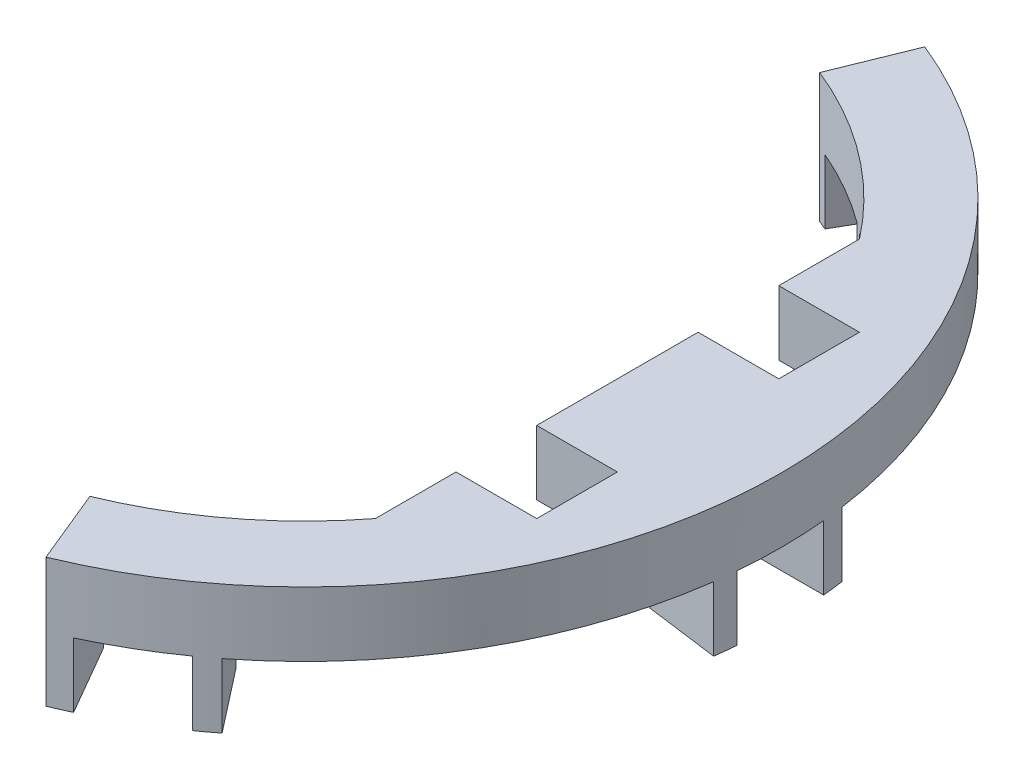
from build123d import *

# Parameters (mm, degrees)
BOSS_EXTRUDE1_DEPTH   = 8
BOSS_EXTRUDE1_2_DEPTH = 8
BOSS_EXTRUDE1_3_DEPTH = 8
BOSS_EXTRUDE1_4_DEPTH = 8
BOSS_EXTRUDE1_5_DEPTH = 8
BOSS_EXTRUDE1_6_DEPTH = 8
BOSS_EXTRUDE2_DEPTH   = 8
BOSS_EXTRUDE3_DEPTH   = 8
SKETCH7_W             = 10
SKETCH7_H             = 10
CUT_EXTRUDE1_DEPTH    = 70


with BuildPart() as part:
    # Sketch1 → Boss-Extrude1 (new body)
    with BuildSketch(Plane(origin=(0, 0, 0), x_dir=(1, 0, 0), z_dir=(0, 1, 0))):
        with BuildLine():
            Line((48.53037343, 6.767780637), (58.434531273, 8.148960359))
            ThreePointArc((58.434531273, 8.148960359), (58.599760274, 6.860619197), (58.736587944, 5.568952925))
            Line((58.736587944, 5.568952925), (48.68250983, 5.568952925))
            ThreePointArc((48.68250983, 5.568952925), (48.61013747, 6.168835799), (48.53037343, 6.767780637))
        make_face()
    extrude(amount=BOSS_EXTRUDE1_DEPTH)



with BuildPart() as body_2:
    # Sketch1 → Boss-Extrude1 2 (new body)
    with BuildSketch(Plane(origin=(0, 0, 0), x_dir=(1, 0, 0), z_dir=(0, 1, 0))):
        with BuildLine():
            Line((18.404116756, 45.412426564), (22.160058951, 54.68026872))
            ThreePointArc((22.160058951, 54.68026872), (23.358409627, 54.179190652), (24.545439267, 53.651853754))
            Line((24.545439267, 53.651853754), (19.518400209, 44.944766695))
            ThreePointArc((19.518400209, 44.944766695), (18.962700221, 45.18203183), (18.404116756, 45.412426564))
        make_face()
    extrude(amount=BOSS_EXTRUDE1_2_DEPTH)


with BuildPart() as body_3:
    # Sketch1 → Boss-Extrude1 3 (new body)
    with BuildSketch(Plane(origin=(0, 0, 0), x_dir=(1, 0, 0), z_dir=(0, 1, 0))):
        with BuildLine():
            Line((29.904437191, 38.816551061), (36.007383557, 46.738296175))
            ThreePointArc((36.007383557, 46.738296175), (34.969196448, 47.520051555), (33.914042358, 48.278750304))
            Line((33.914042358, 48.278750304), (28.890208092, 39.577214106))
            ThreePointArc((28.890208092, 39.577214106), (29.399782832, 39.200162875), (29.904437191, 38.816551061))
        make_face()
    extrude(amount=BOSS_EXTRUDE1_3_DEPTH)


with BuildPart() as body_4:
    # Sketch1 → Boss-Extrude1 4 (new body)
    with BuildSketch(Plane(origin=(0, 0, 0), x_dir=(1, 0, 0), z_dir=(0, 1, 0))):
        with BuildLine():
            Line((48.568337902, -6.489726763), (58.480243596, -7.814160796))
            ThreePointArc((58.480243596, -7.814160796), (58.63817006, -6.524186697), (58.767645405, -5.231047075))
            Line((58.767645405, -5.231047075), (48.719976873, -5.231047075))
            ThreePointArc((48.719976873, -5.231047075), (48.648228298, -5.860877361), (48.568337902, -6.489726763))
        make_face()
    extrude(amount=BOSS_EXTRUDE1_4_DEPTH)


with BuildPart() as body_5:
    # Sketch1 → Boss-Extrude1 5 (new body)
    with BuildSketch(Plane(origin=(0, 0, 0), x_dir=(1, 0, 0), z_dir=(0, 1, 0))):
        with BuildLine():
            Line((30.126256674, -38.644645927), (36.274472321, -46.531308361))
            ThreePointArc((36.274472321, -46.531308361), (35.241350648, -47.318571455), (34.191148678, -48.082900829))
            Line((34.191148678, -48.082900829), (29.16410962, -39.37581377))
            ThreePointArc((29.16410962, -39.37581377), (29.647437249, -39.013196031), (30.126256674, -38.644645927))
        make_face()
    extrude(amount=BOSS_EXTRUDE1_5_DEPTH)


with BuildPart() as body_6:
    # Sketch1 → Boss-Extrude1 6 (new body)
    with BuildSketch(Plane(origin=(0, 0, 0), x_dir=(1, 0, 0), z_dir=(0, 1, 0))):
        with BuildLine():
            Line((18.66390071, -45.306277824), (22.472860039, -54.552456972))
            ThreePointArc((22.472860039, -54.552456972), (23.668973612, -54.044238251), (24.853603047, -53.509797379))
            Line((24.853603047, -53.509797379), (19.829768781, -44.808261181))
            ThreePointArc((19.829768781, -44.808261181), (19.248445466, -45.061040236), (18.66390071, -45.306277824))
        make_face()
    extrude(amount=BOSS_EXTRUDE1_6_DEPTH)


with BuildPart() as part_1:
    add(part.part)

    add(body_2.part)  # Boss-Extrude2 merges body 2

    add(body_3.part)  # Boss-Extrude2 merges body 3

    add(body_4.part)  # Boss-Extrude2 merges body 4

    add(body_5.part)  # Boss-Extrude2 merges body 5

    add(body_6.part)  # Boss-Extrude2 merges body 6
    # Sketch2 → Boss-Extrude2 (add)
    with BuildSketch(Plane(origin=(0, 8, 0), x_dir=(1, 0, 0), z_dir=(0, 1, 0))):
        with BuildLine():
            Line((22.160058951, 54.68026872), (18.404116756, 45.412426564))
            ThreePointArc((18.404116756, 45.412426564), (48.999799093, 0.140316836), (18.66390071, -45.306277824))
            Line((18.66390071, -45.306277824), (22.472860039, -54.552456972))
            ThreePointArc((22.472860039, -54.552456972), (58.999758092, 0.168952925), (22.160058951, 54.68026872))
        make_face()
    extrude(amount=BOSS_EXTRUDE2_DEPTH)

    # Sketch3 → Boss-Extrude3 (add)
    with BuildSketch(Plane.XZ.offset(-8)):
        with BuildLine():
            Line((38.742741256, -30), (38.742741256, 30))
            ThreePointArc((38.742741256, 30), (49, 0), (38.742741256, -30))
        make_face()
    extrude(amount=-BOSS_EXTRUDE3_DEPTH)

    # Sketch7 → Cut-Extrude1 (cut)
    with BuildSketch(Plane(origin=(0, 16, 0), x_dir=(1, 0, 0), z_dir=(0, 1, 0))):
        with Locations((43.742741256, 15)):
            Rectangle(SKETCH7_W, SKETCH7_H)
        with Locations((43.742741256, -15)):
            Rectangle(SKETCH7_W, SKETCH7_H)
    extrude(amount=-CUT_EXTRUDE1_DEPTH, mode=Mode.SUBTRACT)


solid = part_1.part
